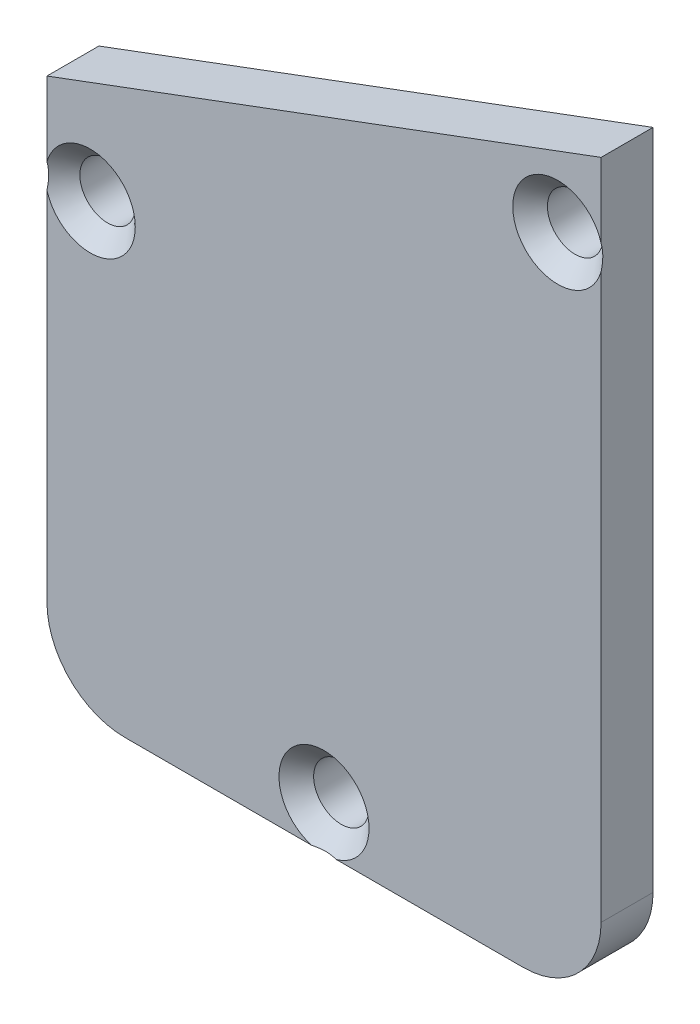
from build123d import *

# Parameters (mm, degrees)
DODANIE_WYCI_GNI_CIE1_DEPTH = 3
SZKIC2_R                    = 1.6
WYTNIJ_WYCI_GNI_CIE1_DEPTH  = 3
SFAZOWANIE1_SIZE            = 1


with BuildPart() as part:
    # Szkic1 → Dodanie-wyciągnięcie1 (new body)
    with BuildSketch(Plane.XY):
        with BuildLine():
            Line((16.79955852, 22.699230769), (-15.20044148, 10.769230769))
            Line((-15.20044148, 10.769230769), (-15.20044148, -15.560769231))
            ThreePointArc((-15.20044148, -15.560769231), (-13.882421995, -18.742749746), (-10.70044148, -20.060769231))
            Line((-10.70044148, -20.060769231), (12.29955852, -20.060769231))
            ThreePointArc((12.29955852, -20.060769231), (15.481539035, -18.742749746), (16.79955852, -15.560769231))
            Line((16.79955852, -15.560769231), (16.79955852, 22.699230769))
        make_face()
    extrude(amount=DODANIE_WYCI_GNI_CIE1_DEPTH)

    # Szkic2 → Wytnij-wyciągnięcie1 (cut)
    with BuildSketch(Plane.XY.offset(3)):
        with Locations((-12.70044148, 5.769230769)):
            Circle(SZKIC2_R)
        with Locations((14.29955852, 17.699230769)):
            Circle(SZKIC2_R)
        with Locations((0.79955852, -17.560769231)):
            Circle(SZKIC2_R)
    extrude(amount=-WYTNIJ_WYCI_GNI_CIE1_DEPTH, mode=Mode.SUBTRACT)

    # Sfazowanie1
    # the kernel refuses this chamfer: 1 mm, written as the material it takes off along each edge
    with BuildSketch(Plane(origin=(-12.70044148, 5.769230769, 3), x_dir=(1, 0, 0), z_dir=(0, -1, 0))) as sfazowanie1_piece_1:
        Polygon((1.6 + SFAZOWANIE1_SIZE, 0), (1.6, -SFAZOWANIE1_SIZE), (1.6, 0), align=None)
    revolve(axis=Axis((-12.70044148, 5.769230769, 3), (0, 0, 1)), mode=Mode.SUBTRACT)
    with BuildSketch(Plane(origin=(14.29955852, 17.699230769, 3), x_dir=(1, 0, 0), z_dir=(0, -1, 0))) as sfazowanie1_piece_2:
        Polygon((1.6 + SFAZOWANIE1_SIZE, 0), (1.6, -SFAZOWANIE1_SIZE), (1.6, 0), align=None)
    revolve(axis=Axis((14.29955852, 17.699230769, 3), (0, 0, 1)), mode=Mode.SUBTRACT)
    with BuildSketch(Plane(origin=(0.79955852, -17.560769231, 3), x_dir=(1, 0, 0), z_dir=(0, -1, 0))) as sfazowanie1_piece_3:
        Polygon((1.6 + SFAZOWANIE1_SIZE, 0), (1.6, -SFAZOWANIE1_SIZE), (1.6, 0), align=None)
    revolve(axis=Axis((0.79955852, -17.560769231, 3), (0, 0, 1)), mode=Mode.SUBTRACT)


solid = part.part
